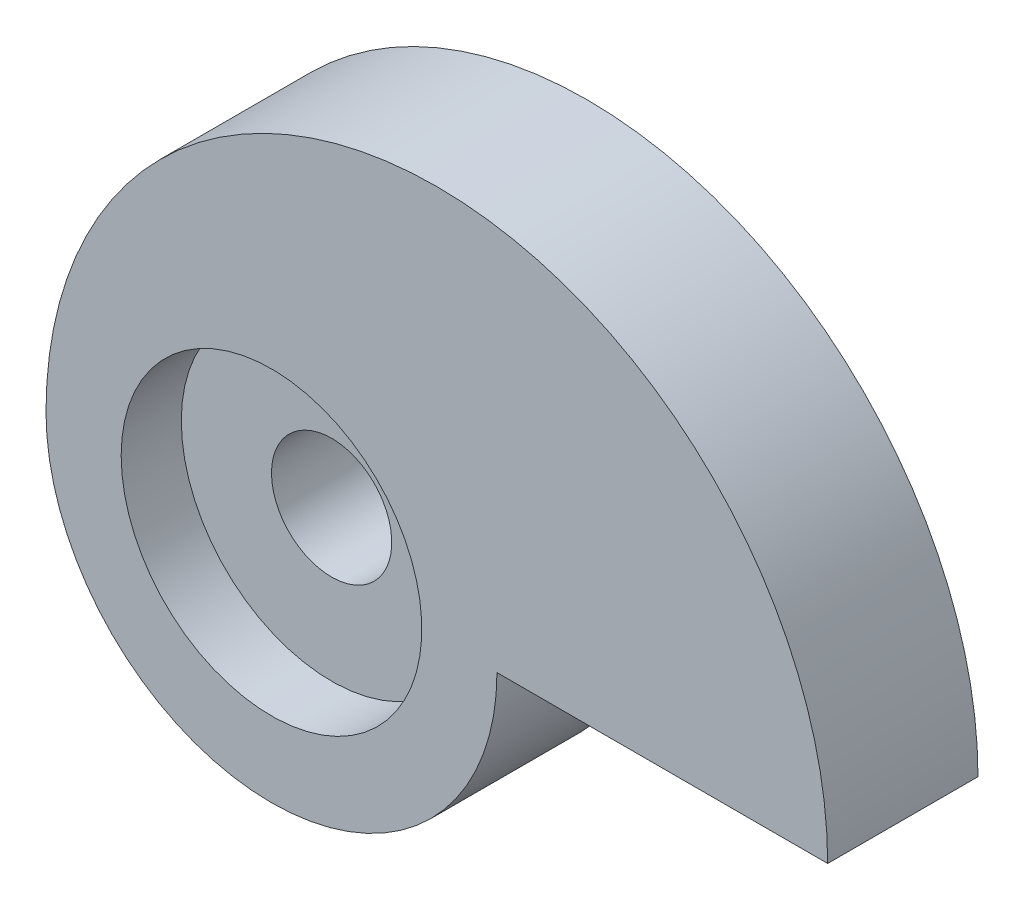
from build123d import *

# Parameters (mm, degrees)
SKETCH1_R           = 2
BOSS_EXTRUDE1_DEPTH = 5
BOSS_EXTRUDE2_START = -5
SKETCH3_R           = 5
SKETCH3_R_2         = 2
BOSS_EXTRUDE2_DEPTH = 5
SKETCH4_W           = 13.002851436
SKETCH4_H           = 2
CUT_EXTRUDE1_DEPTH  = 3
FILLET1_R           = 1
CUT_EXTRUDE2_START  = 2
SKETCH5_R           = 5
CUT_EXTRUDE2_DEPTH  = 2
FILLET2_R           = 1.5


with BuildPart() as part:
    # Sketch1 → Boss-Extrude1 (new body)
    with BuildSketch(Plane.XY):
        with BuildLine():
            Line((2, 0), (13, 0))
            ThreePointArc((13, 0), (0, 13), (-13, 0))
            ThreePointArc((-13, 0), (-5.5, -7.5), (2, 0))
        make_face()
        with Locations((-5.5, 0)):
            Circle(SKETCH1_R, mode=Mode.SUBTRACT)
    extrude(amount=BOSS_EXTRUDE1_DEPTH)

    # Sketch3 → Boss-Extrude2 (add)
    with BuildSketch(Plane.XY.offset(BOSS_EXTRUDE2_START)):
        with Locations((-5.5, 0)):
            Circle(SKETCH3_R)
        with Locations((-5.5, 0)):
            Circle(SKETCH3_R_2, mode=Mode.SUBTRACT)
    extrude(amount=BOSS_EXTRUDE2_DEPTH)

    # Sketch4 → Cut-Extrude1 (cut)
    with BuildSketch(Plane(origin=(0, 0, -5), x_dir=(-1, 0, 0), z_dir=(0, 0, -1))):
        with Locations((5.5, 0)):
            Rectangle(SKETCH4_W, SKETCH4_H)
    extrude(amount=-CUT_EXTRUDE1_DEPTH, mode=Mode.SUBTRACT)

    # Fillet1
    fillet1_edges = [part.edges().sort_by_distance(p)[0] for p in [
        (-8.815515147, 1, -2),
        (-2.184484853, 1, -2),
        (-8.815515147, -1, -2),
        (-2.184484853, -1, -2),
    ]]
    fillet(fillet1_edges, radius=FILLET1_R - 0.0001)  # a hair under: the kernel refuses the full size

    # Sketch5 → Cut-Extrude2 (cut)
    with BuildSketch(Plane(origin=(0, 0, 5), x_dir=(-1, 0, 0), z_dir=(0, 0, -1)).offset(CUT_EXTRUDE2_START)):
        with Locations(Location((5.5, 0, 0), (0, 0, 180))):
            Circle(SKETCH5_R)
    extrude(amount=-CUT_EXTRUDE2_DEPTH, mode=Mode.SUBTRACT)

    # Fillet2
    fillet2_edges = [part.edges().sort_by_distance(p)[0] for p in [
        (-10.5, 0, 0),
    ]]
    fillet(fillet2_edges, radius=FILLET2_R)


solid = part.part
